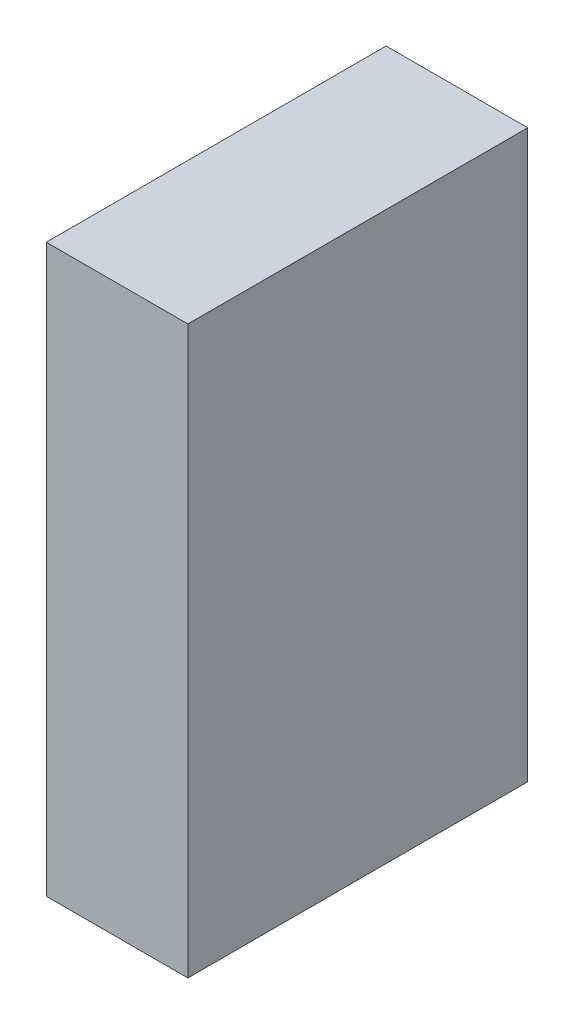
from build123d import *

# Parameters (mm, degrees)
SKETCH1_W           = 15.875
SKETCH1_H           = 63.5
BOSS_EXTRUDE1_DEPTH = 38.1


with BuildPart() as part:
    # Sketch1 → Boss-Extrude1 (new body)
    with BuildSketch(Plane.XY):
        with Locations((7.9375, 31.75)):
            Rectangle(SKETCH1_W, SKETCH1_H)
    extrude(amount=BOSS_EXTRUDE1_DEPTH)


solid = part.part
